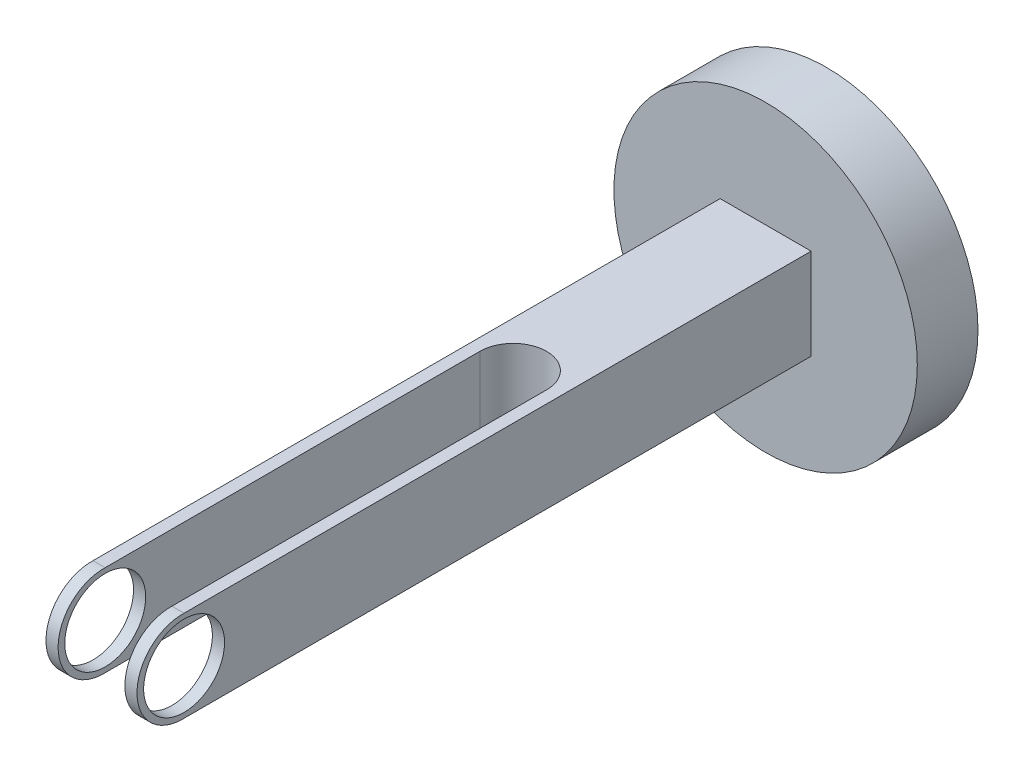
from build123d import *

# Parameters (mm, degrees)
SKETCH1_R           = 75
BOSS_EXTRUDE1_DEPTH = 30
SKETCH2_W           = 45
SKETCH2_H           = 45
BOSS_EXTRUDE2_DEPTH = 335.79
CUT_EXTRUDE1_DEPTH  = 380
SKETCH4_R           = 20
CUT_EXTRUDE2_DEPTH  = 380
CUT_EXTRUDE3_DEPTH  = 380


with BuildPart() as part:
    # Sketch1 → Boss-Extrude1 (new body)
    with BuildSketch(Plane.XY):
        Circle(SKETCH1_R)
    extrude(amount=BOSS_EXTRUDE1_DEPTH)

    # Sketch2 → Boss-Extrude2 (add)
    with BuildSketch(Plane.XY.offset(30)):
        Rectangle(SKETCH2_W, SKETCH2_H)
    extrude(amount=BOSS_EXTRUDE2_DEPTH)

    # Sketch3 → Cut-Extrude1 (cut)
    with BuildSketch(Plane(origin=(22.5, 0, 0), x_dir=(0, 0, -1), z_dir=(1, 0, 0))):
        with BuildLine():
            Line((-339.214523501, 22.444773864), (-418.327166589, 27.997964586))
            Line((-418.327166589, 27.997964586), (-417.734381188, -27.051143031))
            Line((-417.734381188, -27.051143031), (-340.79, -22.5))
            ThreePointArc((-340.79, -22.5), (-363.276189227, 0.78822207), (-339.214523501, 22.444773864))
        make_face()
    extrude(amount=-CUT_EXTRUDE1_DEPTH, mode=Mode.SUBTRACT)

    # Sketch4 → Cut-Extrude2 (cut)
    with BuildSketch(Plane(origin=(22.5, 0, 0), x_dir=(0, 0, -1), z_dir=(1, 0, 0))):
        with Locations((-340.001293813, 0)):
            Circle(SKETCH4_R)
    extrude(amount=-CUT_EXTRUDE2_DEPTH, mode=Mode.SUBTRACT)

    # Sketch5 → Cut-Extrude3 (cut)
    with BuildSketch(Plane(origin=(0, 22.5, 0), x_dir=(1, 0, 0), z_dir=(0, 1, 0))):
        with BuildLine():
            ThreePointArc((16.5, -154.792040417), (0, -138.292040417), (-16.5, -154.792040417))
            Line((-16.5, -154.792040417), (-16.5, -435.160891931))
            Line((-16.5, -435.160891931), (16.5, -435.160891931))
            Line((16.5, -435.160891931), (16.5, -154.792040417))
        make_face()
    extrude(amount=-CUT_EXTRUDE3_DEPTH, mode=Mode.SUBTRACT)


solid = part.part
